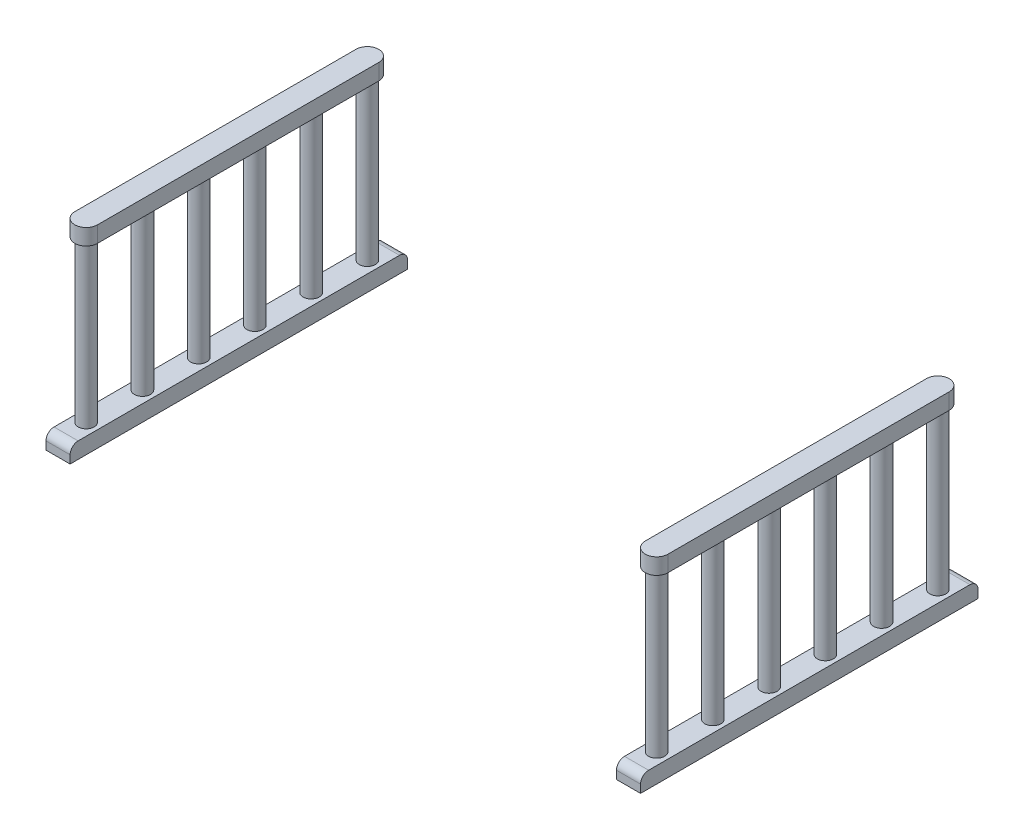
from build123d import *

# Parameters (mm, degrees)
SKETCH2_W             = 150
SKETCH2_H             = 2100
BOSS_EXTRUDE3_DEPTH   = 100
BOSS_EXTRUDE3_2_DEPTH = 100
SKETCH3_R             = 50
BOSS_EXTRUDE4_DEPTH   = 1000
LPATTERN1_COUNT       = 6
LPATTERN1_PITCH       = 350
SKETCH5_R             = 50
BOSS_EXTRUDE5_DEPTH   = 1000
LPATTERN2_COUNT       = 6
LPATTERN2_PITCH       = 350
FILLET1_R             = 50
FILLET2_R             = 50
FILLET3_R             = 50
FILLET4_R             = 50
BOSS_EXTRUDE8_DEPTH   = 100


with BuildPart() as part:
    # Sketch2 → Boss-Extrude3 (new body)
    with BuildSketch(Plane(origin=(0, 0, 0), x_dir=(1, 0, 0), z_dir=(0, 1, 0))):
        with Locations((1775, 1037.975951904)):
            Rectangle(SKETCH2_W, SKETCH2_H)
    extrude(amount=BOSS_EXTRUDE3_DEPTH)

    # Sketch5 → Boss-Extrude5 (add)
    with BuildSketch(Plane(origin=(0, 100, 0), x_dir=(1, 0, 0), z_dir=(0, 1, 0))):
        with Locations((1775, 1912.975951904)):
            Circle(SKETCH5_R)
    boss_extrude5 = extrude(amount=BOSS_EXTRUDE5_DEPTH)

    # LPattern2: Boss-Extrude5 ×6
    with Locations(*[(0, 0, i * LPATTERN2_PITCH) for i in range(1, LPATTERN2_COUNT)]):
        add(boss_extrude5)

    # Fillet3
    fillet3_edges = [part.edges().sort_by_distance(p)[0] for p in [
        (1775, 100, 12.024048096),
    ]]
    fillet(fillet3_edges, radius=FILLET3_R)

    # Fillet4
    fillet4_edges = [part.edges().sort_by_distance(p)[0] for p in [
        (1775, 100, -2087.975951904),
    ]]
    fillet(fillet4_edges, radius=FILLET4_R)



with BuildPart() as body_2:
    # Sketch2 → Boss-Extrude3 2 (new body)
    with BuildSketch(Plane(origin=(0, 0, 0), x_dir=(1, 0, 0), z_dir=(0, 1, 0))):
        with Locations((-1775, 1037.975951904)):
            Rectangle(SKETCH2_W, SKETCH2_H)
    extrude(amount=BOSS_EXTRUDE3_2_DEPTH)

    # Sketch3 → Boss-Extrude4 (add)
    with BuildSketch(Plane(origin=(0, 100, 0), x_dir=(1, 0, 0), z_dir=(0, 1, 0))):
        with Locations((-1775, 162.975951904)):
            Circle(SKETCH3_R)
    boss_extrude4 = extrude(amount=BOSS_EXTRUDE4_DEPTH)

    # LPattern1: Boss-Extrude4 ×6
    with Locations(*[(0, 0, -i * LPATTERN1_PITCH) for i in range(1, LPATTERN1_COUNT)]):
        add(boss_extrude4)

    # Fillet1
    fillet1_edges = [body_2.edges().sort_by_distance(p)[0] for p in [
        (-1775, 100, -2087.975951904),
    ]]
    fillet(fillet1_edges, radius=FILLET1_R)

    # Fillet2
    fillet2_edges = [body_2.edges().sort_by_distance(p)[0] for p in [
        (-1775, 100, 12.024048096),
    ]]
    fillet(fillet2_edges, radius=FILLET2_R)


with BuildPart() as part_1:
    add(part.part)

    add(body_2.part)  # Boss-Extrude8 merges body 2
    # Sketch13 → Boss-Extrude8 (add)
    with BuildSketch(Plane(origin=(0, 1100, 0), x_dir=(1, 0, 0), z_dir=(0, 1, 0))):
        with BuildLine():
            Line((-1845.838339321, 162.975951904), (-1845.838339321, 1912.975951904))
            ThreePointArc((-1845.838339321, 1912.975951904), (-1775, 1983.814291225), (-1704.161660679, 1912.975951904))
            Line((-1704.161660679, 1912.975951904), (-1704.161660679, 162.975951904))
            ThreePointArc((-1704.161660679, 162.975951904), (-1775, 92.137612583), (-1845.838339321, 162.975951904))
        make_face()
        with BuildLine():
            Line((1845.838339321, 162.975951904), (1845.838339321, 1912.975951904))
            ThreePointArc((1845.838339321, 1912.975951904), (1775, 1983.814291225), (1704.161660679, 1912.975951904))
            Line((1704.161660679, 1912.975951904), (1704.161660679, 162.975951904))
            ThreePointArc((1704.161660679, 162.975951904), (1775, 92.137612583), (1845.838339321, 162.975951904))
        make_face()
    extrude(amount=BOSS_EXTRUDE8_DEPTH)


solid = part_1.part
